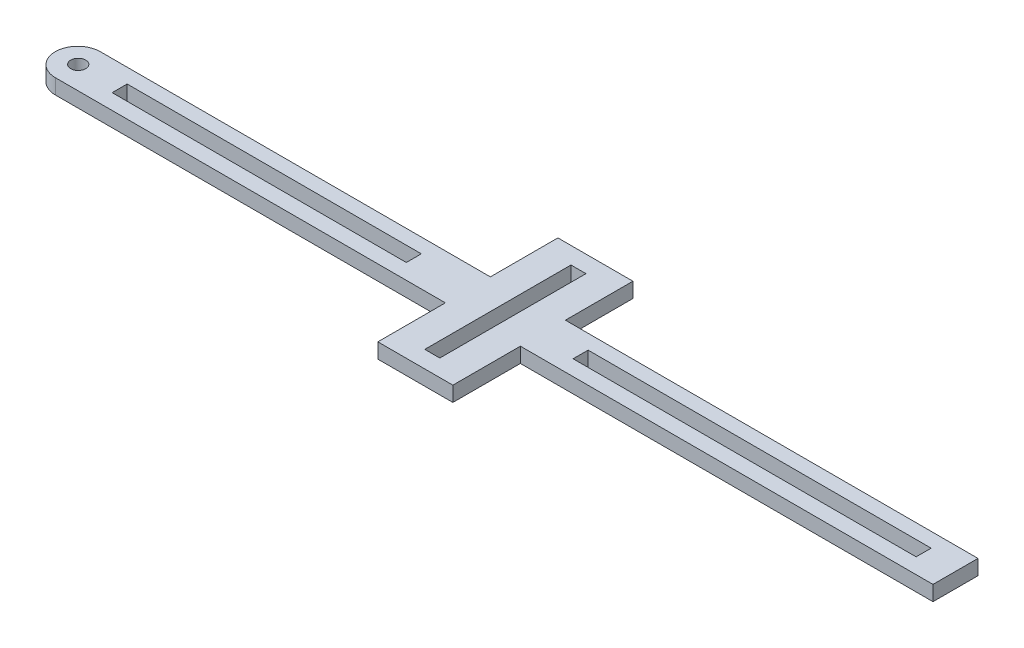
from build123d import *

# Parameters (mm, degrees)
SKETCH1_R           = 1
SKETCH1_W           = 39.213246084
SKETCH1_H           = 2
SKETCH1_W_2         = 45.726803631
SKETCH1_W_3         = 2
SKETCH1_H_2         = 19.484553002
BOSS_EXTRUDE1_DEPTH = 2
FILLET1_R           = 3


with BuildPart() as part:
    # Sketch1 → Boss-Extrude1 (new body)
    with BuildSketch(Plane(origin=(0, 0, 0), x_dir=(1, 0, 0), z_dir=(0, 1, 0))):
        Polygon((-5, 3), (-5, 12), (5, 12), (5, 3), (60, 3), (60, -3), (5, -3), (5, -12), (-5, -12), (-5, -3), (-60, -3), (-60, 3), align=None)
        with Locations(Location((-57, 0.057494984, 0), (0, 0, 270))):
            Circle(SKETCH1_R, mode=Mode.SUBTRACT)
        with Locations((-31.867954369, 0.057494984)):
            Rectangle(SKETCH1_W, SKETCH1_H, mode=Mode.SUBTRACT)
        with Locations((32.832738322, 0.057494984)):
            Rectangle(SKETCH1_W_2, SKETCH1_H, mode=Mode.SUBTRACT)
        Rectangle(SKETCH1_W_3, SKETCH1_H_2, mode=Mode.SUBTRACT)
    extrude(amount=BOSS_EXTRUDE1_DEPTH)

    # Fillet1
    fillet1_edges = [part.edges().sort_by_distance(p)[0] for p in [
        (-60, 1, 3),
        (-60, 1, -3),
    ]]
    fillet(fillet1_edges, radius=FILLET1_R - 0.0001)  # a hair under: the kernel refuses the full size


solid = part.part
